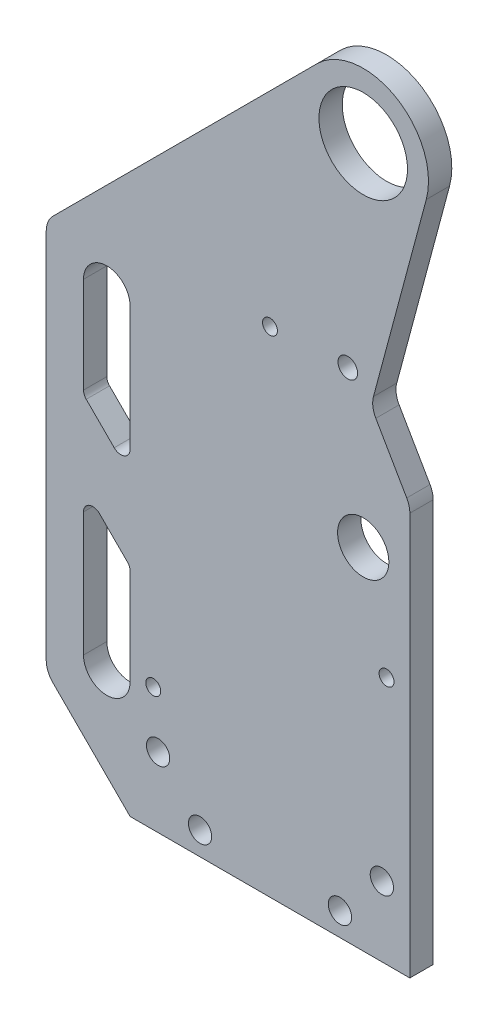
from build123d import *

# Parameters (mm, degrees)
SKETCH1_W           = 80
SKETCH1_H           = 180
SKETCH1_R           = 9.5
BOSS_EXTRUDE1_DEPTH = 5
SKETCH2_R           = 5.5
CUT_EXTRUDE1_DEPTH  = 30
SKETCH3_R           = 1.6
SKETCH3_R_2         = 2.5
CUT_EXTRUDE2_DEPTH  = 5
CUT_EXTRUDE3_DEPTH  = 10
BOSS_EXTRUDE2_DEPTH = 5
FILLET1_R           = 2
FILLET2_R           = 5
SKETCH6_R           = 2.1
CUT_EXTRUDE4_DEPTH  = 5


with BuildPart() as part:
    # Sketch1 → Boss-Extrude1 (new body)
    with BuildSketch(Plane.XY):
        with Locations((10, 166)):
            Rectangle(SKETCH1_W, SKETCH1_H)
        with Locations((20, 226)):
            Circle(SKETCH1_R, mode=Mode.SUBTRACT)
    extrude(amount=BOSS_EXTRUDE1_DEPTH)

    # Sketch2 → Cut-Extrude1 (cut)
    with BuildSketch(Plane.XY.offset(5)):
        with Locations((20, 151)):
            Circle(SKETCH2_R)
    extrude(amount=-CUT_EXTRUDE1_DEPTH, mode=Mode.SUBTRACT)

    # Sketch3 → Cut-Extrude2 (cut)
    with BuildSketch(Plane.XY.offset(5)):
        with Locations((0, 182)):
            Circle(SKETCH3_R)
        with Locations((25, 129.301270189)):
            Circle(SKETCH3_R)
        with Locations((-25.032859693, 102.533479235)):
            Circle(SKETCH3_R)
        with Locations((-15, 81)):
            Circle(SKETCH3_R_2)
        with Locations((15, 81)):
            Circle(SKETCH3_R_2)
        with Locations((24, 91)):
            Circle(SKETCH3_R_2)
        with Locations((-24, 91)):
            Circle(SKETCH3_R_2)
    extrude(amount=-CUT_EXTRUDE2_DEPTH, mode=Mode.SUBTRACT)

    # Sketch4 → Cut-Extrude3 (cut)
    with BuildSketch(Plane.XY.offset(5)):
        with BuildLine():
            Line((-30, 195.798989873), (10.100505063, 235.899494937))
            ThreePointArc((10.100505063, 235.899494937), (25.357568053, 238.934313455), (34, 226))
            ThreePointArc((34, 226), (33.880228059, 224.172633309), (33.522961568, 222.376533369))
            Line((33.522961568, 222.376533369), (21.663923351, 178.118000215))
            Line((21.663923351, 178.118000215), (30, 163.679491924))
            Line((30, 163.679491924), (30, 76))
            Line((30, 76), (50, 76))
            Line((50, 76), (50, 256))
            Line((50, 256), (-30, 256))
            Line((-30, 256), (-30, 195.798989873))
        make_face()
    extrude(amount=-CUT_EXTRUDE3_DEPTH, mode=Mode.SUBTRACT)

    # Sketch5 → Boss-Extrude2 (add)
    with BuildSketch(Plane.XY.offset(5)):
        with BuildLine():
            Line((-30, 170.798989873), (-30, 195.798989873))
            Line((-30, 195.798989873), (-46.535533906, 179.263455967))
            ThreePointArc((-46.535533906, 179.263455967), (-47.619397663, 177.641339223), (-48, 175.727922061))
            Line((-48, 175.727922061), (-48, 96.071067812))
            ThreePointArc((-48, 96.071067812), (-47.619397663, 94.15765065), (-46.535533906, 92.535533906))
            Line((-46.535533906, 92.535533906), (-30, 76))
            Line((-30, 76), (-30, 101))
            ThreePointArc((-30, 101), (-35, 96), (-40, 101))
            Line((-40, 101), (-40, 132.414213562))
            Line((-40, 132.414213562), (-30, 122.414213562))
            Line((-30, 122.414213562), (-30, 139.384776311))
            Line((-30, 139.384776311), (-40, 149.384776311))
            Line((-40, 149.384776311), (-40, 170.798989873))
            ThreePointArc((-40, 170.798989873), (-35, 175.798989873), (-30, 170.798989873))
        make_face()
    extrude(amount=-BOSS_EXTRUDE2_DEPTH)

    # Fillet1
    fillet1_edges = [part.edges().sort_by_distance(p)[0] for p in [
        (-40, 132.414213562, 2.5),
        (-40, 149.384776311, 2.5),
        (-30, 122.414213562, 2.5),
        (-30, 139.384776311, 2.5),
    ]]
    fillet(fillet1_edges, radius=FILLET1_R)

    # Fillet2
    fillet2_edges = [part.edges().sort_by_distance(p)[0] for p in [
        (30, 163.679491924, 2.5),
        (21.663923351, 178.118000215, 2.5),
    ]]
    fillet(fillet2_edges, radius=FILLET2_R)

    # Sketch6 → Cut-Extrude4 (cut)
    with BuildSketch(Plane.XY.offset(5)):
        with Locations((16.689231857, 182.734418636)):
            Circle(SKETCH6_R)
    extrude(amount=-CUT_EXTRUDE4_DEPTH, mode=Mode.SUBTRACT)


solid = part.part
